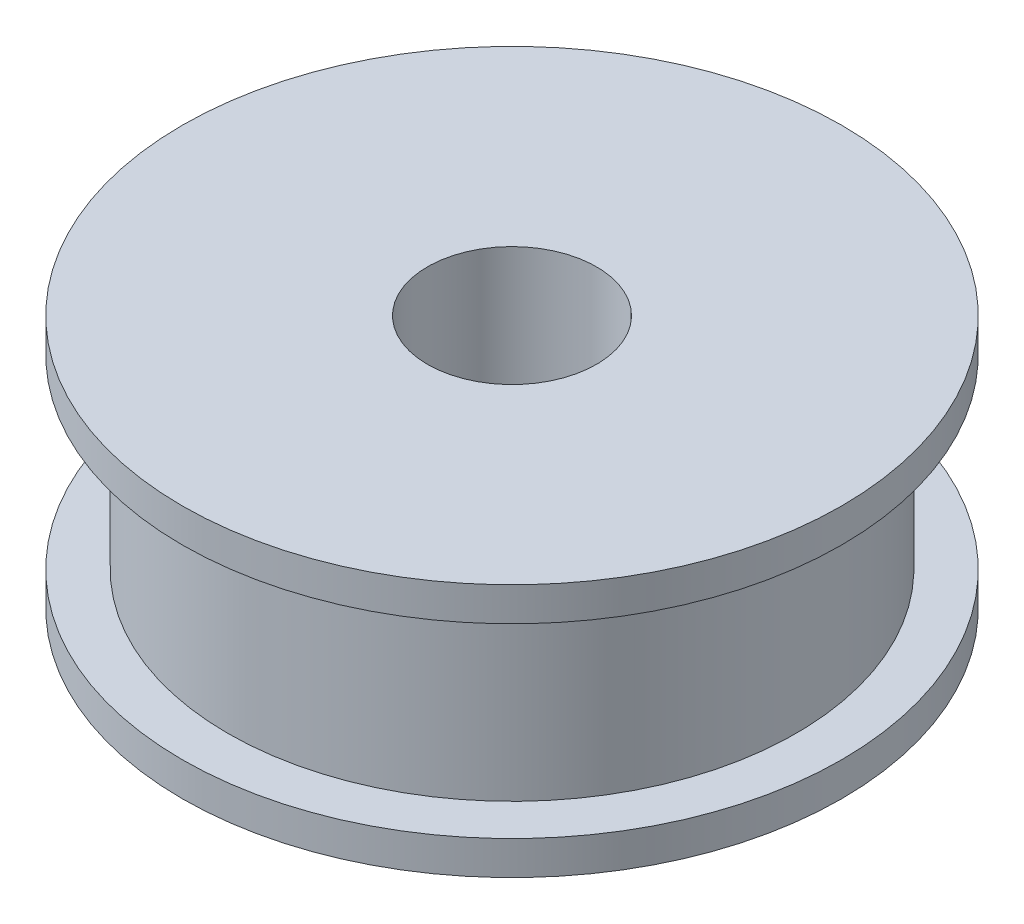
from build123d import *

# Parameters (mm, degrees)
SKETCH_2_R          = 5
CUT_EXTRUDE_1_DEPTH = 32.392674305


with BuildPart() as part:
    # 草图1 → 旋转1 (revolve)
    with BuildSketch(Plane.XY):
        Polygon((0, 0), (19.5, 0), (19.5, -2), (16.805, -2), (16.805, -13), (19.5, -13), (19.5, -15), (0, -15), align=None)
    revolve(axis=Axis((0, 23.575757576, 0), (0, -1, 0)))

    # 草图2 → 切除-拉伸1 (cut, through all)
    with BuildSketch(Plane(origin=(0, 0, 0), x_dir=(1, 0, 0), z_dir=(0, 1, 0))):
        Circle(SKETCH_2_R)
    extrude(amount=-CUT_EXTRUDE_1_DEPTH, mode=Mode.SUBTRACT)


solid = part.part
